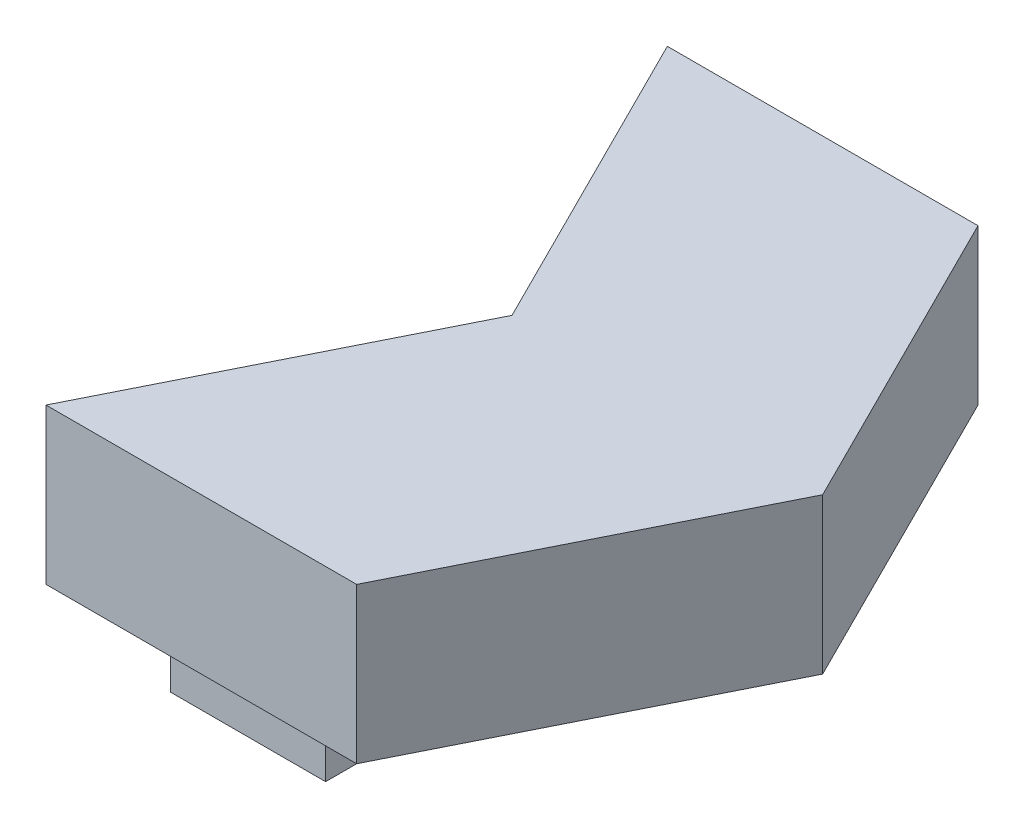
from build123d import *

# Parameters (mm, degrees)
BOSS_EXTRUDE1_DEPTH = 6.35
SKETCH2_R           = 5.127000033
CUT_EXTRUDE1_DEPTH  = 2.699999934
CUT_EXTRUDE2_DEPTH  = 2.699999934
SKETCH4_W           = 6.35
SKETCH4_H           = 2.54
BOSS_EXTRUDE2_DEPTH = 2.54


with BuildPart() as part:
    # Sketch1 → Boss-Extrude1 (new body)
    with BuildSketch(Plane(origin=(0, 0, 0), x_dir=(1, 0, 0), z_dir=(0, 1, 0))):
        Polygon((0, 0), (12.7, 0), (19.05, 12.7), (12.7, 25.4), (0, 25.4), (6.35, 12.7), align=None)
    extrude(amount=BOSS_EXTRUDE1_DEPTH)

    # Sketch2 → Cut-Extrude1 (cut)
    with BuildSketch(Plane.XZ):
        with Locations((12.192, -12.7)):
            Circle(SKETCH2_R)
    extrude(amount=-CUT_EXTRUDE1_DEPTH, mode=Mode.SUBTRACT)

    # Sketch3 → Cut-Extrude2 (cut)
    with BuildSketch(Plane.XZ):
        Polygon((11.106516251, -17.710773829), (8.834671186, -16.574851297), (7.130787387, -19.982618895), (9.402632452, -21.118541427), align=None)
    extrude(amount=-CUT_EXTRUDE2_DEPTH, mode=Mode.SUBTRACT)

    # Sketch4 → Boss-Extrude2 (add)
    with BuildSketch(Plane.XZ):
        with Locations((6.985, -22.86)):
            Rectangle(SKETCH4_W, SKETCH4_H)
    boss_extrude2 = extrude(amount=BOSS_EXTRUDE2_DEPTH)

    # Mirror1: Boss-Extrude2 across plane
    add(boss_extrude2.mirror(Plane(origin=(0, 0, -12.7), x_dir=(1, 0, 0), z_dir=(0, 0, -1))))


solid = part.part
